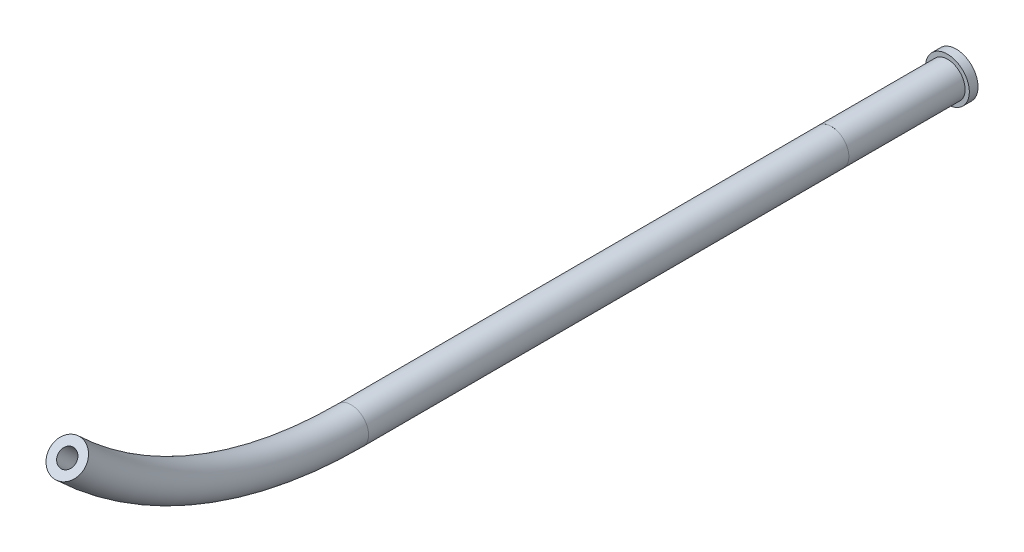
from build123d import *

# Parameters (mm, degrees)
EXTRUDE_START         = -13.29129993
EXTRUDE_1_OUTLINE_R   = 2
EXTRUDE_1_OUTLINE_R_2 = 1
EXTRUDE_1_DEPTH       = 13.29129993
EXTRUDE_START_2       = -14
EXTRUDE_1_2_OUTLINE_W = 7
EXTRUDE_1_2_OUTLINE_H = 7
EXTRUDE_1_2_DEPTH     = 0.712285549
SWEEP_1_PROFILE_R     = 2
SWEEP_1_PROFILE_R_2   = 1
SKETCH_48_R           = 2.5
SKETCH_48_R_2         = 0.99999967
EXTRUDE_2_DEPTH       = 1


with BuildPart() as part:
    # 填料-伸長1: read off the stored shape, not the designer's step
    # 填料-伸長1 outline → 填料-伸長1 (new body)
    with BuildSketch(Plane.XY.offset(EXTRUDE_START)):
        with Locations((0, -15.066296733)):
            Circle(EXTRUDE_1_OUTLINE_R)
        with Locations((0, -15.066296733)):
            Circle(EXTRUDE_1_OUTLINE_R_2, mode=Mode.SUBTRACT)
    extrude(amount=EXTRUDE_1_DEPTH)

    # Extrude 1 2 outline → Extrude 1 2 (cut)
    with BuildSketch(Plane(origin=(0, 0, 0), x_dir=(0.9999984119942068, 0, -0.0017821360960043895), z_dir=(0.0017821360960043895, 0, 0.9999984119942068)).offset(EXTRUDE_START_2)):
        with Locations((0.5, -15.5)):
            Rectangle(EXTRUDE_1_2_OUTLINE_W, EXTRUDE_1_2_OUTLINE_H)
    extrude(amount=EXTRUDE_1_2_DEPTH, mode=Mode.SUBTRACT)

    # 草圖48 → 填料-伸長2 (add)
    with BuildSketch(Plane(origin=(-0.023680516, 0, -13.28769335), x_dir=(-0.9999984119942069, 0, 0.001782136096004392), z_dir=(-0.001782136096004392, 0, -0.9999984119942069))):
        with Locations((0, -15.066296733)):
            Circle(SKETCH_48_R)
        with Locations(Location((0, -15.066296733, 0), (0, 0, 270))):
            Circle(SKETCH_48_R_2, mode=Mode.SUBTRACT)
    extrude(amount=EXTRUDE_2_DEPTH)


with BuildPart() as body_2:
    # 掃出-薄件1: sweep along a path in 草圖2
    with BuildLine(Plane(origin=(0, 0, 0), x_dir=(0.001782136096004214, 0, 0.9999984119942069), z_dir=(-0.9999984119942069, 0, 0.001782136096004214))) as sweep_1_path:
        Line((0.003564272, -15.066296733), (55.003564272, -15.066296733))
        ThreePointArc((55.003564272, -15.066296733), (72.503564272, -11.695734296), (87.499717891, -2.066296733))
    # 掃出-薄件1 profile (on start of the path) → 掃出-薄件1 (sweep)
    with BuildSketch(Plane(origin=(6.352e-06, -15.066296733, 0.003564267), x_dir=(0.9999984119942069, 0, -0.001782136096004214), z_dir=(0.001782136096004214, 0, 0.9999984119942069))):
        Circle(SWEEP_1_PROFILE_R)
        Circle(SWEEP_1_PROFILE_R_2, mode=Mode.SUBTRACT)
    sweep(path=sweep_1_path.line)


solid = Compound([part.part, body_2.part])
